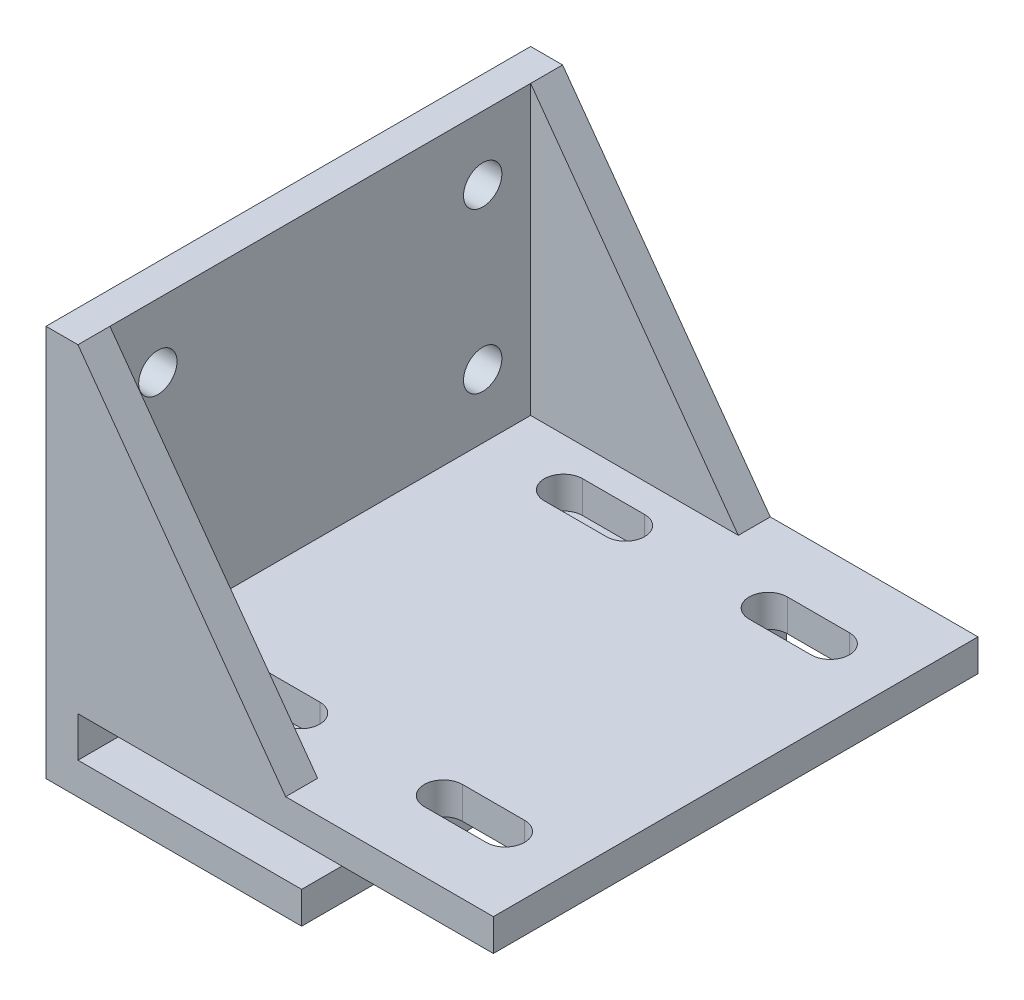
from build123d import *

# Parameters (mm, degrees)
SKETCH1_W                 = 70
SKETCH1_H                 = 15
BOSS_EXTRUDE1_DEPTH       = 5
SKETCH3_W                 = 5
SKETCH3_H                 = 15
BOSS_EXTRUDE2_DEPTH       = 45
F_6_0MM_DOWEL_HOLE1_D     = 6
F_6_0MM_DOWEL_SLOT1_DEPTH = 5
BOSS_EXTRUDE3_DEPTH       = 50.83
F_6_0MM_DOWEL_SLOT2_DEPTH = 5
F_6_0MM_DOWEL_HOLE2_D     = 6
F_6_0MM_DOWEL_HOLE2_DEPTH = 7.999
F_6_0MM_DOWEL_HOLE2_TIP   = 1.802581857
BOSS_EXTRUDE4_DEPTH       = 5
BOSS_EXTRUDE5_DEPTH       = 5
SKETCH19_W                = 5
SKETCH19_H                = 75.83
BOSS_EXTRUDE6_DEPTH       = 11.3
SKETCH20_W                = 75.83
SKETCH20_H                = 5
BOSS_EXTRUDE7_DEPTH       = 35
F_6_0MM_START             = -11.3
F_6_0MM_DOWEL_SLOT3_DEPTH = 5


# Read off the part's stored shape, not the designer's step: Ø6.0mm Dowel Slot1, Ø6.0mm Dowel Slot2, Ø6.0mm Dowel Slot3
with BuildPart() as part:
    # Sketch1 → Boss-Extrude1 (new body)
    with BuildSketch(Plane(origin=(0, 0, 0), x_dir=(1, 0, 0), z_dir=(0, 1, 0))):
        with Locations((4.827783478, -3.453636176)):
            Rectangle(SKETCH1_W, SKETCH1_H)
    extrude(amount=BOSS_EXTRUDE1_DEPTH)

    # Sketch3 → Boss-Extrude2 (add)
    with BuildSketch(Plane(origin=(0, 5, 0), x_dir=(1, 0, 0), z_dir=(0, 1, 0))):
        with Locations((-27.672216522, -3.453636176)):
            Rectangle(SKETCH3_W, SKETCH3_H)
    extrude(amount=BOSS_EXTRUDE2_DEPTH)

    # Ø6.0mm Dowel Hole1 (through all)
    with Locations(Plane.ZY.offset(30.172216522)):
        with Locations((3.453636176, 15), (3.453636176, 40)):
            Hole(F_6_0MM_DOWEL_HOLE1_D / 2)

    # Ø6.0mm Dowel Slot1 outline → Ø6.0mm Dowel Slot1 (cut)
    with BuildSketch(Plane(origin=(0, 0, 0), x_dir=(1, 0, 0), z_dir=(0, 1, 0))):
        with BuildLine():
            Line((19.509331286, -6.453444287), (29.209331286, -6.453444287))
            ThreePointArc((29.209331286, -6.453444287), (32.209331286, -3.453444287), (29.209331286, -0.453444287))
            Line((29.209331286, -0.453444287), (19.509331286, -0.453444287))
            ThreePointArc((19.509331286, -0.453444287), (16.509331286, -3.453444287), (19.509331286, -6.453444287))
        make_face()
        with BuildLine():
            Line((-12.530668714, -6.453557031), (-2.830668714, -6.453557031))
            ThreePointArc((-2.830668714, -6.453557031), (0.169331286, -3.453557031), (-2.830668714, -0.453557031))
            Line((-2.830668714, -0.453557031), (-12.530668714, -0.453557031))
            ThreePointArc((-12.530668714, -0.453557031), (-15.530668714, -3.453557031), (-12.530668714, -6.453557031))
        make_face()
    extrude(amount=F_6_0MM_DOWEL_SLOT1_DEPTH, mode=Mode.SUBTRACT)

    # Sketch10 → Boss-Extrude3 (add)
    with BuildSketch(Plane(origin=(0, 0, -4.046363824), x_dir=(-1, 0, 0), z_dir=(0, 0, -1))):
        Polygon((-39.827783478, 5), (-39.827783478, 0), (30.172216522, 0), (30.172216522, 50), (25.172216522, 50), (25.172216522, 5), align=None)
    extrude(amount=BOSS_EXTRUDE3_DEPTH)

    # Ø6.0mm Dowel Slot2 outline → Ø6.0mm Dowel Slot2 (cut)
    with BuildSketch(Plane(origin=(0, 0, 0), x_dir=(1, 0, 0), z_dir=(0, 1, 0))):
        with BuildLine():
            Line((19.509331286, 44.376555713), (29.209331286, 44.376555713))
            ThreePointArc((29.209331286, 44.376555713), (32.209331286, 47.376555713), (29.209331286, 50.376555713))
            Line((29.209331286, 50.376555713), (19.509331286, 50.376555713))
            ThreePointArc((19.509331286, 50.376555713), (16.509331286, 47.376555713), (19.509331286, 44.376555713))
        make_face()
        with BuildLine():
            Line((-12.530668714, 44.376442969), (-2.830668714, 44.376442969))
            ThreePointArc((-2.830668714, 44.376442969), (0.169331286, 47.376442969), (-2.830668714, 50.376442969))
            Line((-2.830668714, 50.376442969), (-12.530668714, 50.376442969))
            ThreePointArc((-12.530668714, 50.376442969), (-15.530668714, 47.376442969), (-12.530668714, 44.376442969))
        make_face()
    extrude(amount=F_6_0MM_DOWEL_SLOT2_DEPTH, mode=Mode.SUBTRACT)

    # Ø6.0mm Dowel Hole2
    with Locations(Plane(origin=(-25.172216522, 0, 0), x_dir=(0, 0, -1), z_dir=(1, 0, 0))):
        with Locations((47.376442969, 40), (47.376442969, 15)):
            Hole(F_6_0MM_DOWEL_HOLE2_D / 2, depth=F_6_0MM_DOWEL_HOLE2_DEPTH)
            with Locations((0, 0, -(F_6_0MM_DOWEL_HOLE2_DEPTH + F_6_0MM_DOWEL_HOLE2_TIP / 2))):  # 118° drill point
                Cone(0, F_6_0MM_DOWEL_HOLE2_D / 2, F_6_0MM_DOWEL_HOLE2_TIP, mode=Mode.SUBTRACT)

    # Sketch17 → Boss-Extrude4 (add)
    with BuildSketch(Plane.XY.offset(10.953636176)):
        Polygon((-25.172216522, 50), (7.327783478, 5), (39.827783478, 5), (39.827783478, 0), (7.327783478, 0), (-30.172216522, 0), (-30.172216522, 50), align=None)
    extrude(amount=BOSS_EXTRUDE4_DEPTH)

    # Sketch18 → Boss-Extrude5 (add)
    with BuildSketch(Plane(origin=(0, 0, -54.876363824), x_dir=(-1, 0, 0), z_dir=(0, 0, -1))):
        Polygon((25.172216522, 50), (-7.327783478, 5), (-39.827783478, 5), (-39.827783478, 0), (30.172216522, 0), (30.172216522, 50), align=None)
    extrude(amount=BOSS_EXTRUDE5_DEPTH)

    # Sketch19 → Boss-Extrude6 (add)
    with BuildSketch(Plane.XZ):
        with Locations((-27.672216522, -21.961363824)):
            Rectangle(SKETCH19_W, SKETCH19_H)
    extrude(amount=BOSS_EXTRUDE6_DEPTH)

    # Sketch20 → Boss-Extrude7 (add)
    with BuildSketch(Plane(origin=(-25.172216522, 0, 0), x_dir=(0, 0, -1), z_dir=(1, 0, 0))):
        with Locations((21.961363824, -8.8)):
            Rectangle(SKETCH20_W, SKETCH20_H)
    extrude(amount=BOSS_EXTRUDE7_DEPTH)

    # Ø6.0mm Dowel Slot3 outline → Ø6.0mm Dowel Slot3 (cut)
    with BuildSketch(Plane(origin=(0, 0, 0), x_dir=(1, 0, 0), z_dir=(0, 1, 0)).offset(F_6_0MM_START)):
        with BuildLine():
            Line((-12.530668714, -6.453557031), (-2.830668714, -6.453557031))
            ThreePointArc((-2.830668714, -6.453557031), (0.169331286, -3.453557031), (-2.830668714, -0.453557031))
            Line((-2.830668714, -0.453557031), (-12.530668714, -0.453557031))
            ThreePointArc((-12.530668714, -0.453557031), (-15.530668714, -3.453557031), (-12.530668714, -6.453557031))
        make_face()
        with BuildLine():
            Line((-12.530668714, 44.376442969), (-2.830668714, 44.376442969))
            ThreePointArc((-2.830668714, 44.376442969), (0.169331286, 47.376442969), (-2.830668714, 50.376442969))
            Line((-2.830668714, 50.376442969), (-12.530668714, 50.376442969))
            ThreePointArc((-12.530668714, 50.376442969), (-15.530668714, 47.376442969), (-12.530668714, 44.376442969))
        make_face()
    extrude(amount=F_6_0MM_DOWEL_SLOT3_DEPTH, mode=Mode.SUBTRACT)


solid = part.part
